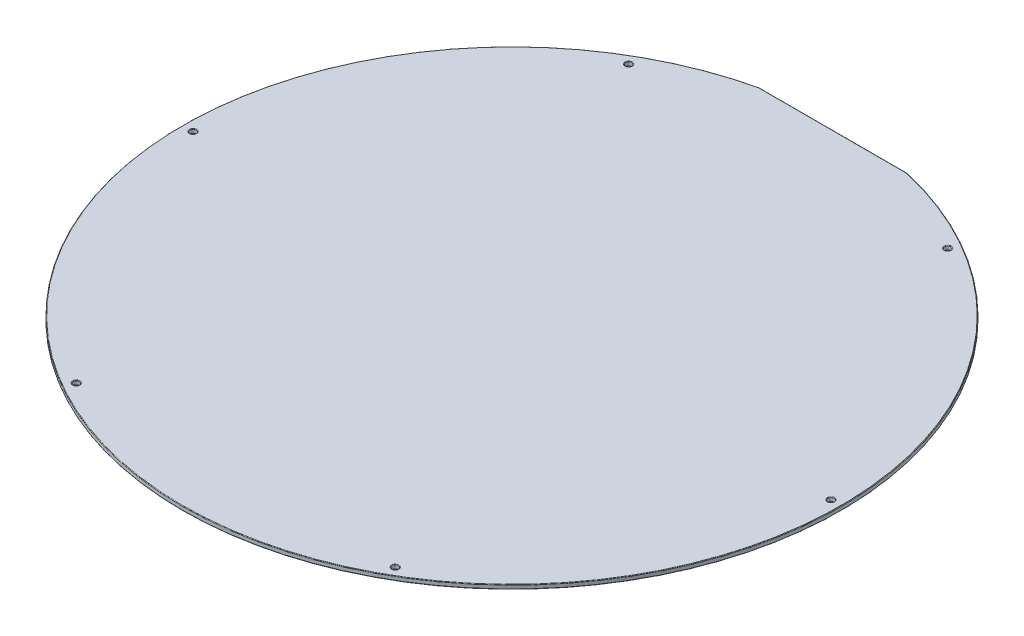
from build123d import *

# Parameters (mm, degrees)
BOSS_EXTRUDE1_OUTLINE_R = 1.5
BOSS_EXTRUDE1_DEPTH     = 2
FILLET1_R               = 0.25


# Read off the part's stored shape, not the designer's step: Boss-Extrude1
with BuildPart() as part:
    # Boss-Extrude1 outline → Boss-Extrude1 (new body)
    with BuildSketch(Plane(origin=(0, 0, 0), x_dir=(1, 0, 0), z_dir=(0, 1, 0))):
        with BuildLine():
            ThreePointArc((-35, 150.996688705), (0, -155), (35, 150.996688705))
            Line((35, 150.996688705), (-35, 150.996688705))
        make_face()
        with Locations((-75, -129.903810568)):
            Circle(BOSS_EXTRUDE1_OUTLINE_R, mode=Mode.SUBTRACT)
        with Locations((75, -129.903810568)):
            Circle(BOSS_EXTRUDE1_OUTLINE_R, mode=Mode.SUBTRACT)
        with Locations((-150, 0)):
            Circle(BOSS_EXTRUDE1_OUTLINE_R, mode=Mode.SUBTRACT)
        with Locations((-75, 129.903810568)):
            Circle(BOSS_EXTRUDE1_OUTLINE_R, mode=Mode.SUBTRACT)
        with Locations((150, 0)):
            Circle(BOSS_EXTRUDE1_OUTLINE_R, mode=Mode.SUBTRACT)
        with Locations((75, 129.903810568)):
            Circle(BOSS_EXTRUDE1_OUTLINE_R, mode=Mode.SUBTRACT)
    extrude(amount=BOSS_EXTRUDE1_DEPTH)

    # Fillet1
    fillet1_edges = [part.edges().sort_by_distance(p)[0] for p in [
        (148.5, 0, 0),
        (148.5, 2, 0),
        (73.5, 0, 129.903810568),
        (73.5, 2, 129.903810568),
        (-76.5, 0, 129.903810568),
        (-76.5, 2, 129.903810568),
        (-151.5, 0, 0),
        (-151.5, 2, 0),
        (-76.5, 0, -129.903810568),
        (-76.5, 2, -129.903810568),
        (0, 0, -150.996688705),
        (0, 0, 155),
        (0, 2, 155),
        (0, 2, -150.996688705),
        (73.5, 0, -129.903810568),
        (73.5, 2, -129.903810568),
    ]]
    fillet(fillet1_edges, radius=FILLET1_R)


solid = part.part
